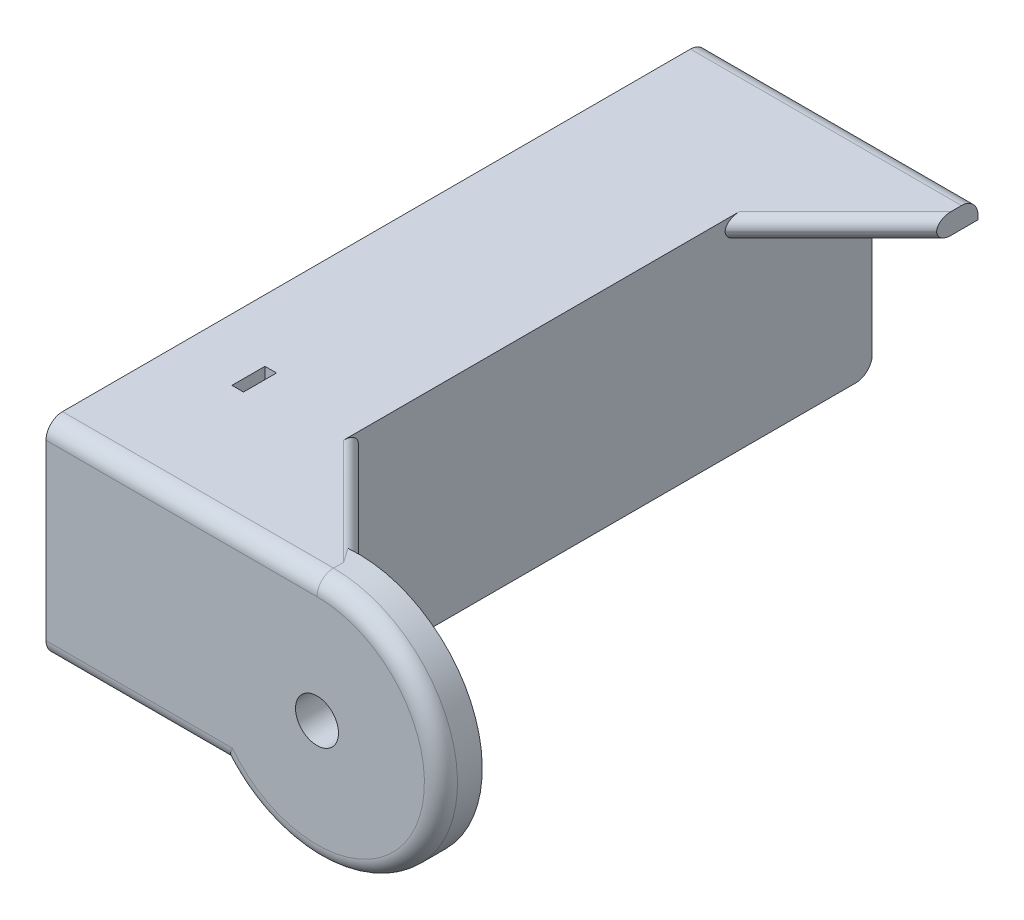
from build123d import *

# Parameters (mm, degrees)
SKETCH1_W             = 25.4
SKETCH1_H             = 101.6
TOP_DEPTH             = 4.7625
SKETCH2_W             = 25.4
SKETCH2_H             = 101.6
SKETCH2_W_2           = 15.875
SKETCH2_H_2           = 88.9
WALLS_DEPTH           = 31.75
SKETCH9_R             = 3.302
JOINT_HINGE_DEPTH     = 6.35
SKETCH3_R             = 3.175
SHAFT_HOLES_DEPTH     = 23.876
SKETCH13_W            = 1.778
SKETCH13_H            = 5.08
WIRE_LOFT_MOUNT_DEPTH = 12.7
ANTI_FLEX_DEPTH       = 3.175
FILLET1_R             = 2.54
FILLET2_R             = 1.5875


with BuildPart() as part:
    # Sketch1 → Top (new body)
    with BuildSketch(Plane(origin=(0, 0, 0), x_dir=(1, 0, 0), z_dir=(0, 1, 0))):
        Rectangle(SKETCH1_W, SKETCH1_H)
    extrude(amount=TOP_DEPTH)

    # Sketch2 → Walls (add)
    with BuildSketch(Plane(origin=(0, 4.7625, 0), x_dir=(1, 0, 0), z_dir=(0, 1, 0))):
        Rectangle(SKETCH2_W, SKETCH2_H)
        Rectangle(SKETCH2_W_2, SKETCH2_H_2, mode=Mode.SUBTRACT)
    extrude(amount=-WALLS_DEPTH)

    # Sketch9 → Joint Hinge (add)
    with BuildSketch(Plane(origin=(0, 0, 50.8), x_dir=(-1, 0, 0), z_dir=(0, 0, -1))):
        with BuildLine():
            Line((-28.956, 4.7625), (-12.7, 4.7625))
            Line((-12.7, 4.7625), (-12.7, -26.9875))
            Line((-12.7, -26.9875), (-14.756968343, -26.9875))
            ThreePointArc((-14.756968343, -26.9875), (-46.346191201, -22.064629933), (-28.956, 4.7625))
        make_face()
        with Locations((-28.956, -14.2875)):
            Circle(SKETCH9_R, mode=Mode.SUBTRACT)
    extrude(amount=JOINT_HINGE_DEPTH)

    # Sketch3 → Shaft holes (cut)
    with BuildSketch(Plane.ZY.offset(12.7)):
        with Locations((38.1, -11.1125)):
            Circle(SKETCH3_R)
        with BuildLine():
            Line((-25.601638938, -12.7), (-23.061638938, -12.7))
            Line((-23.061638938, -12.7), (-23.061638938, -9.525))
            Line((-23.061638938, -9.525), (-25.601638938, -9.525))
            ThreePointArc((-25.601638938, -9.525), (-38.1, -11.1125), (-25.601638938, -12.7))
        make_face()
    extrude(amount=-SHAFT_HOLES_DEPTH, mode=Mode.SUBTRACT)

    # Sketch13 → Wire Loft Mount (cut)
    with BuildSketch(Plane.XZ):
        with Locations((-2.286, 29.21)):
            Rectangle(SKETCH13_W, SKETCH13_H)
    extrude(amount=-WIRE_LOFT_MOUNT_DEPTH, mode=Mode.SUBTRACT)

    # Sketch15 → Anti-flex (add)
    with BuildSketch(Plane(origin=(0, 4.7625, 0), x_dir=(1, 0, 0), z_dir=(0, 1, 0))):
        Polygon((12.7, -44.45), (28.956, -44.45), (12.7, -28.194), align=None)
        Polygon((12.7, 28.194), (28.956, 44.45), (28.956, 50.8), (12.7, 50.8), align=None)
    extrude(amount=-ANTI_FLEX_DEPTH)

    # Fillet1
    fillet1_edges = [part.edges().sort_by_distance(p)[0] for p in [
        (8.128, 4.7625, -50.8),
        (0, -26.9875, -50.8),
        (1.028484171, -26.9875, 50.8),
        (46.346191201, -22.064629933, 50.8),
        (8.128, 4.7625, 50.8),
    ]]
    fillet(fillet1_edges, radius=FILLET1_R)

    # Fillet2
    # the kernel refuses this fillet: 1.5875 mm, written as the material it takes off along each edge
    with BuildSketch(Plane(origin=(9.893669962, 1.5875, -25.387669962), x_dir=(-0.7071067811865515, 0, -0.7071067811865436), z_dir=(0.7071067811865437, 0, -0.7071067811865515))) as fillet2_piece_1_section:
        with BuildLine():
            CenterArc((FILLET2_R, FILLET2_R), FILLET2_R, 180, 90)
            Line((0, FILLET2_R), (0, 0))
            Line((0, 0), (FILLET2_R, 0))
        make_face()
    fillet2_piece_1 = extrude(amount=30.92695567, mode=Mode.PRIVATE)
    fillet2_piece_1 = split(fillet2_piece_1, bisect_by=Plane(origin=(12.7, 1.942096603, -36.823475324), z_dir=(1, 0, 0)), keep=Keep.TOP, mode=Mode.PRIVATE)
    add(fillet2_piece_1, mode=Mode.SUBTRACT)
    with BuildSketch(Plane(origin=(9.893669962, 4.7625, -25.387669962), x_dir=(-0.7071067811865515, 0, -0.7071067811865436), z_dir=(0.7071067811865437, 0, -0.7071067811865515))) as fillet2_piece_2_section:
        with BuildLine():
            CenterArc((FILLET2_R, -FILLET2_R), FILLET2_R, 90, 90)
            Line((0, -FILLET2_R), (0, 0))
            Line((0, 0), (FILLET2_R, 0))
        make_face()
    fillet2_piece_2 = extrude(amount=30.92695567, mode=Mode.PRIVATE)
    fillet2_piece_2 = split(fillet2_piece_2, bisect_by=Plane(origin=(12.7, 4.407903397, -36.823475324), z_dir=(1, 0, 0)), keep=Keep.TOP, mode=Mode.PRIVATE)
    add(fillet2_piece_2, mode=Mode.SUBTRACT)
    with BuildSketch(Plane(origin=(31.762330038, 1.5875, 47.256330038), x_dir=(-0.7071067811865436, 0, 0.7071067811865515), z_dir=(-0.7071067811865515, 0, -0.7071067811865436))) as fillet2_piece_3_section:
        with BuildLine():
            CenterArc((FILLET2_R, FILLET2_R), FILLET2_R, 180, 90)
            Line((0, FILLET2_R), (0, 0))
            Line((0, 0), (FILLET2_R, 0))
        make_face()
    fillet2_piece_3 = extrude(amount=30.92695567, mode=Mode.PRIVATE)
    fillet2_piece_3 = split(fillet2_piece_3, bisect_by=Plane(origin=(12.7, 1.946775649, 36.567113542), z_dir=(1, 0, 0)), keep=Keep.TOP, mode=Mode.PRIVATE)
    fillet2_piece_3 = split(fillet2_piece_3, bisect_by=Plane(origin=(20.582886458, 1.946775649, 44.45), z_dir=(0, 0, -1)), keep=Keep.TOP, mode=Mode.PRIVATE)
    add(fillet2_piece_3, mode=Mode.SUBTRACT)
    with BuildSketch(Plane(origin=(31.762330038, 4.7625, 47.256330038), x_dir=(-0.7071067811865436, 0, 0.7071067811865515), z_dir=(-0.7071067811865515, 0, -0.7071067811865436))) as fillet2_piece_4_section:
        with BuildLine():
            CenterArc((FILLET2_R, -FILLET2_R), FILLET2_R, 90, 90)
            Line((0, -FILLET2_R), (0, 0))
            Line((0, 0), (FILLET2_R, 0))
        make_face()
    fillet2_piece_4 = extrude(amount=30.92695567, mode=Mode.PRIVATE)
    fillet2_piece_4 = split(fillet2_piece_4, bisect_by=Plane(origin=(12.7, 4.227310256, 42.469450936), z_dir=(1, 0, 0)), keep=Keep.TOP, mode=Mode.PRIVATE)
    fillet2_piece_4 = split(fillet2_piece_4, bisect_by=Plane(origin=(26.668449599, 4.227310256, 44.45), z_dir=(0, 0, -1)), keep=Keep.TOP, mode=Mode.PRIVATE)
    add(fillet2_piece_4, mode=Mode.SUBTRACT)
    with BuildSketch(Plane(origin=(31.762330038, 4.7625, 47.256330038), x_dir=(-0.7071067811865436, 0, 0.7071067811865515), z_dir=(-0.7071067811865515, 0, -0.7071067811865436))) as fillet2_piece_5_section:
        with BuildLine():
            CenterArc((FILLET2_R, -FILLET2_R), FILLET2_R, 90, 90)
            Line((0, -FILLET2_R), (0, 0))
            Line((0, 0), (FILLET2_R, 0))
        make_face()
    fillet2_piece_5 = extrude(amount=30.92695567, mode=Mode.PRIVATE)
    fillet2_piece_5 = split(fillet2_piece_5, bisect_by=Plane(origin=(27.86835314, 4.749091996, 44.45), z_dir=(0, 0, 1)), keep=Keep.TOP, mode=Mode.PRIVATE)
    fillet2_piece_5 = fillet2_piece_5 - Plane(origin=(28.956, -14.2875, 44.898632057), x_dir=(-0.7453559924999297, -0.6666666666666669, 0), z_dir=(0, 0, 1)) * Cylinder(19.05, 69, mode=Mode.PRIVATE)
    add(fillet2_piece_5, mode=Mode.SUBTRACT)


solid = part.part
